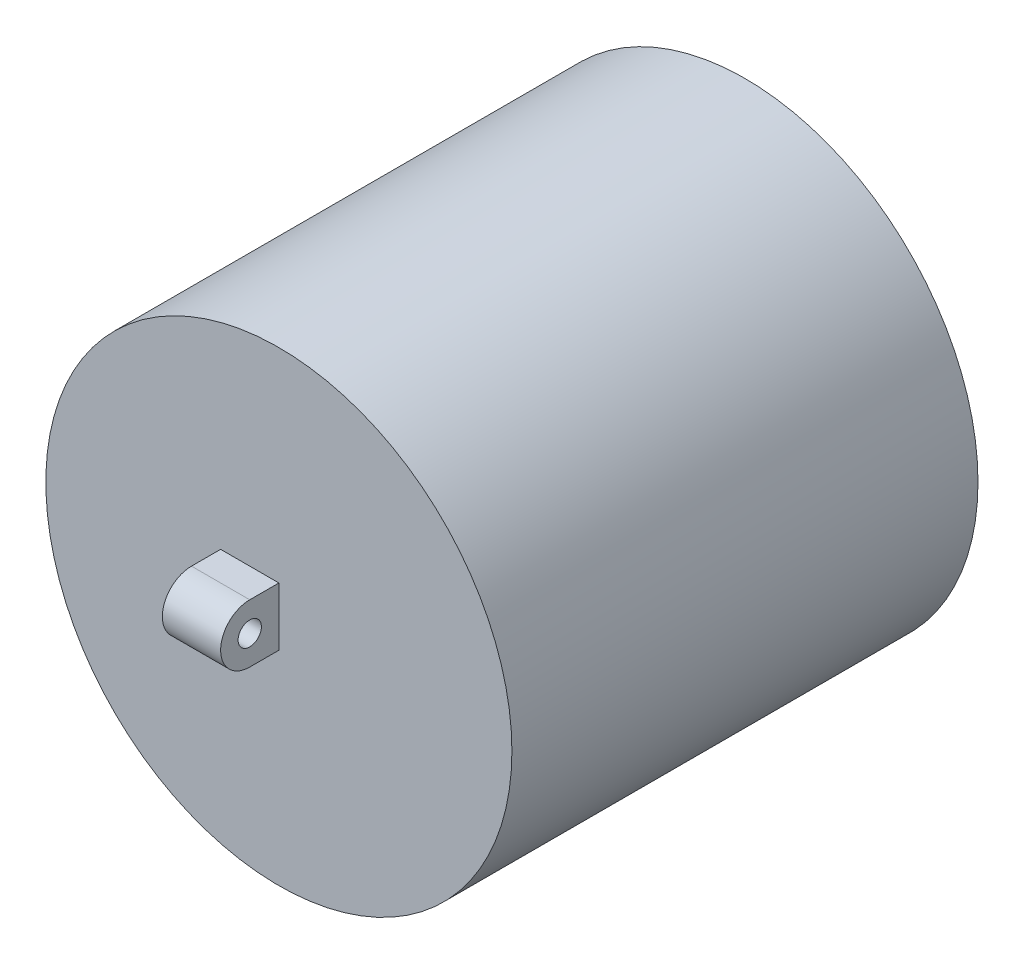
from build123d import *

# Parameters (mm, degrees)
SKETCH2_R           = 12.7
BOSS_EXTRUDE1_DEPTH = 25.4
SKETCH3_W           = 3.175
SKETCH3_H           = 3.175
BOSS_EXTRUDE2_DEPTH = 3.175
CUT_EXTRUDE1_START  = -3.175
CUT_EXTRUDE1_DEPTH  = 3.175
SKETCH6_R           = 0.635
CUT_EXTRUDE2_DEPTH  = 2.54


# Read off the part's stored shape, not the designer's step: Cut-Extrude1
with BuildPart() as part:
    # Sketch2 → Boss-Extrude1 (new body)
    with BuildSketch(Plane.XY):
        Circle(SKETCH2_R)
    extrude(amount=BOSS_EXTRUDE1_DEPTH)

    # Sketch3 → Boss-Extrude2 (add)
    with BuildSketch(Plane.XY.offset(25.4)):
        with Locations((-1.5875, 0)):
            Rectangle(SKETCH3_W, SKETCH3_H)
    extrude(amount=BOSS_EXTRUDE2_DEPTH)

    # Cut-Extrude1 outline → Cut-Extrude1 (cut)
    with BuildSketch(Plane.ZY.offset(3.175).offset(CUT_EXTRUDE1_START)):
        with BuildLine():
            Line((28.575, 1.5875), (26.9875, 1.5875))
            ThreePointArc((26.9875, 1.5875), (28.110032015, 1.122532015), (28.575, 0))
            Line((28.575, 0), (28.575, 1.5875))
        make_face()
        with BuildLine():
            Line((28.575, -1.5875), (28.575, 0))
            ThreePointArc((28.575, 0), (28.110032015, -1.122532015), (26.9875, -1.5875))
            Line((26.9875, -1.5875), (28.575, -1.5875))
        make_face()
    extrude(amount=CUT_EXTRUDE1_DEPTH, mode=Mode.SUBTRACT)

    # Sketch6 → Cut-Extrude2 (cut)
    with BuildSketch(Plane(origin=(0, 0, 0), x_dir=(0, 0, -1), z_dir=(1, 0, 0))):
        with Locations((-26.9875, 0)):
            Circle(SKETCH6_R)
    extrude(amount=-CUT_EXTRUDE2_DEPTH, mode=Mode.SUBTRACT)


solid = part.part
